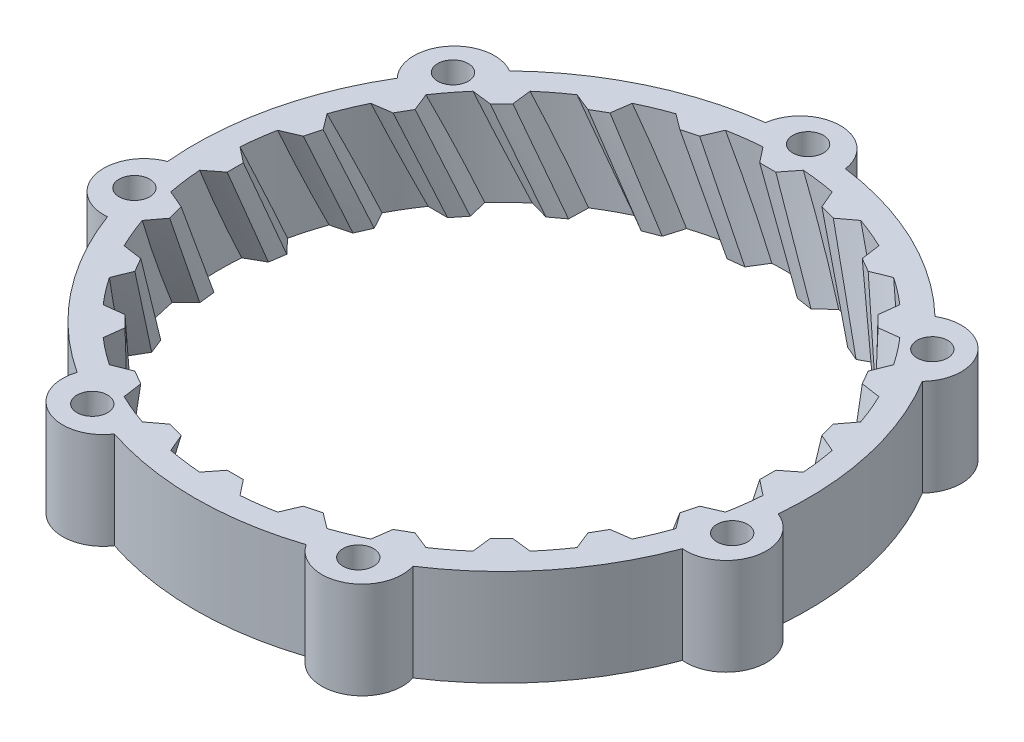
from build123d import *

# Parameters (mm, degrees)
SKETCH1_R           = 38
BOSS_EXTRUDE6_DEPTH = 6
SKETCH3_R           = 38
SKETCH3_R_2         = 35
BOSS_EXTRUDE7_DEPTH = 24
CIRPATTERN1_COUNT   = 24
BOSS_EXTRUDE8_DEPTH = 30
CUT_EXTRUDE1_DEPTH  = 30
CIRPATTERN2_COUNT   = 7
BOSS_EXTRUDE9_DEPTH = 7
SKETCH8_R           = 1.9
CUT_EXTRUDE2_DEPTH  = 13
SKETCH9_R           = 42
CUT_EXTRUDE6_DEPTH  = 18


with BuildPart() as part:
    # Sketch1 → Boss-Extrude6 (new body)
    with BuildSketch(Plane(origin=(0, 0, 0), x_dir=(1, 0, 0), z_dir=(0, 1, 0))):
        with Locations(Location((0, 0, 0), (0, 0, 270))):
            Circle(SKETCH1_R)
    extrude(amount=BOSS_EXTRUDE6_DEPTH)

    # Sketch3 → Boss-Extrude7 (add)
    with BuildSketch(Plane(origin=(0, 6, 0), x_dir=(1, 0, 0), z_dir=(0, 1, 0))):
        with Locations(Location((0, 0, 0), (0, 0, 270))):
            Circle(SKETCH3_R)
        with Locations(Location((0, 0, 0), (0, 0, 270))):
            Circle(SKETCH3_R_2, mode=Mode.SUBTRACT)
    extrude(amount=BOSS_EXTRUDE7_DEPTH)

    # Sketch4 → Loft1 section 0
    with BuildSketch(Plane(origin=(0, 6, 0), x_dir=(1, 0, 0), z_dir=(0, 1, 0))):
        with BuildLine():
            Line((1, 33), (-1, 33))
            Line((-1, 33), (-3.355280929, 36))
            Line((-3.355280929, 36), (3.355280929, 36))
            Line((3.355280929, 36), (1, 33))
        make_face()
    # Sketch5 → Loft1 section 1
    with BuildSketch(Plane(origin=(0, 18, 0), x_dir=(0.9889879611668934, 0, 0.147995988685341), z_dir=(0, 1, 0))):
        with BuildLine():
            Line((1, 33), (-1, 33))
            Line((-1, 33), (-3.355280929, 36))
            Line((-3.355280929, 36), (3.355280929, 36))
            Line((3.355280929, 36), (1, 33))
        make_face()
    loft1 = loft()

    # CirPattern1: Loft1 ×24 about axis
    cirpattern1_axis = Axis((0, 6, 0), (0, -1, 0))
    for i in range(1, CIRPATTERN1_COUNT):
        add(loft1.rotate(cirpattern1_axis, i * 360 / CIRPATTERN1_COUNT))

    # Mirror1: read off the stored shape, not the designer's step
    # Mirror1: loft between two sections, ruled curve by curve
    mirror1_from = [
        Edge.make_bspline([(-1, 30, -33), (-0.666666667, 30, -33), (-0.333333333, 30, -33), (0.333333333, 30, -33), (0.666666667, 30, -33), (1, 30, -33)], [0, 0, 0, 0, 0.5, 0.5, 1, 1, 1, 1], 3),
        Edge.make_bspline([(1, 30, -33), (1.392546821, 30, -33.5), (1.785093643, 30, -34), (2.570187286, 30, -35), (2.962734107, 30, -35.5), (3.355280929, 30, -36)], [0, 0, 0, 0, 0.5, 0.5, 1, 1, 1, 1], 3),
        Edge.make_bspline([(-3.355280929, 30, -36), (-2.962734107, 30, -35.5), (-2.570187286, 30, -35), (-1.785093643, 30, -34), (-1.392546821, 30, -33.5), (-1, 30, -33)], [0, 0, 0, 0, 0.5, 0.5, 1, 1, 1, 1], 3),
        Edge.make_line((-3.355280929, 30, -36), (3.355280929, 30, -36)),
    ]
    mirror1_to = [
        Edge.make_bspline([(3.894879665, 18, -32.784598707), (4.224542319, 18, -32.735266711), (4.554204973, 18, -32.685934715), (5.21353028, 18, -32.587270722), (5.543192934, 18, -32.537938726), (5.872855588, 18, -32.48860673)], [0, 0, 0, 0, 0.5, 0.5, 1, 1, 1, 1], 3),
        Edge.make_bspline([(5.872855588, 18, -32.48860673), (6.335077663, 18, -32.925005355), (6.797299738, 18, -33.361403981), (7.721743888, 18, -34.234201232), (8.183965962, 18, -34.670599858), (8.646188037, 18, -35.106998484)], [0, 0, 0, 0, 0.5, 0.5, 1, 1, 1, 1], 3),
        Edge.make_bspline([(2.009523148, 18, -36.10013472), (2.323749234, 18, -35.547545385), (2.63797532, 18, -34.994956049), (3.266427493, 18, -33.889777378), (3.580653579, 18, -33.337188043), (3.894879665, 18, -32.784598707)], [0, 0, 0, 0, 0.5, 0.5, 1, 1, 1, 1], 3),
        Edge.make_line((2.009523148, 18, -36.10013472), (8.646188037, 18, -35.106998484)),
    ]
    mirror1 = Solid(Shell([*[Face.make_surface_from_curves(mirror1_from[k], mirror1_to[k]) for k in range(4)], Face(Wire(mirror1_from)), Face(Wire(mirror1_to))]))
    add(mirror1)

    # Mirror1 2: loft between two sections, ruled curve by curve
    mirror1_2_from = [
        Edge.make_bspline([(7.575102662, 30, -32.134371313), (7.897077938, 30, -32.048098298), (8.219053213, 30, -31.961825283), (8.863003764, 30, -31.789279253), (9.184979039, 30, -31.703006237), (9.506954315, 30, -31.616733222)], [0, 0, 0, 0, 0.5, 0.5, 1, 1, 1, 1], 3),
        Edge.make_bspline([(9.506954315, 30, -31.616733222), (10.01553495, 30, -31.998097542), (10.524115585, 30, -32.379461862), (11.541276856, 30, -33.142190501), (12.049857492, 30, -33.523554821), (12.558438127, 30, -33.90491914)], [0, 0, 0, 0, 0.5, 0.5, 1, 1, 1, 1], 3),
        Edge.make_bspline([(6.07653312, 30, -35.641740352), (6.326294711, 30, -35.057178846), (6.576056301, 30, -34.472617339), (7.075579481, 30, -33.303494326), (7.325341072, 30, -32.718932819), (7.575102662, 30, -32.134371313)], [0, 0, 0, 0, 0.5, 0.5, 1, 1, 1, 1], 3),
        Edge.make_line((6.07653312, 30, -35.641740352), (12.558438127, 30, -33.90491914)),
    ]
    mirror1_2_to = [
        Edge.make_bspline([(12.247443391, 18, -30.65942156), (12.553105002, 18, -30.526447538), (12.858766613, 18, -30.393473515), (13.470089835, 18, -30.12752547), (13.775751446, 18, -29.994551448), (14.081413057, 18, -29.861577425)], [0, 0, 0, 0, 0.5, 0.5, 1, 1, 1, 1], 3),
        Edge.make_bspline([(14.081413057, 18, -29.861577425), (14.640833572, 18, -30.163474252), (15.200254087, 18, -30.465371079), (16.319095118, 18, -31.069164733), (16.878515633, 18, -31.37106156), (17.437936148, 18, -31.672958387)], [0, 0, 0, 0, 0.5, 0.5, 1, 1, 1, 1], 3),
        Edge.make_bspline([(11.284452703, 18, -34.349949597), (11.444951151, 18, -33.734861591), (11.605449599, 18, -33.119773584), (11.926446495, 18, -31.889597572), (12.086944943, 18, -31.274509566), (12.247443391, 18, -30.65942156)], [0, 0, 0, 0, 0.5, 0.5, 1, 1, 1, 1], 3),
        Edge.make_line((11.284452703, 18, -34.349949597), (17.437936148, 18, -31.672958387)),
    ]
    mirror1_2 = Solid(Shell([*[Face.make_surface_from_curves(mirror1_2_from[k], mirror1_2_to[k]) for k in range(4)], Face(Wire(mirror1_2_from)), Face(Wire(mirror1_2_to))]))
    add(mirror1_2)

    # Mirror1 3: loft between two sections, ruled curve by curve
    mirror1_3_from = [
        Edge.make_bspline([(15.633974596, 30, -29.078838325), (15.922649731, 30, -28.912171658), (16.211324865, 30, -28.745504992), (16.788675135, 30, -28.412171658), (17.077350269, 30, -28.245504992), (17.366025404, 30, -28.078838325)], [0, 0, 0, 0, 0.5, 0.5, 1, 1, 1, 1], 3),
        Edge.make_bspline([(17.366025404, 30, -28.078838325), (17.955980923, 30, -28.315577616), (18.545936443, 30, -28.552316907), (19.725847482, 30, -29.02579549), (20.315803002, 30, -29.262534781), (20.905758521, 30, -29.499274072)], [0, 0, 0, 0, 0.5, 0.5, 1, 1, 1, 1], 3),
        Edge.make_bspline([(15.094241479, 30, -32.854555001), (15.184196998, 30, -32.225268888), (15.274152518, 30, -31.595982775), (15.454063557, 30, -30.33741055), (15.544019077, 30, -29.708124437), (15.633974596, 30, -29.078838325)], [0, 0, 0, 0, 0.5, 0.5, 1, 1, 1, 1], 3),
        Edge.make_line((15.094241479, 30, -32.854555001), (20.905758521, 30, -29.499274072)),
    ]
    mirror1_3_to = [
        Edge.make_bspline([(19.765364089, 18, -26.444855501), (20.026194323, 18, -26.237301412), (20.287024558, 18, -26.029747323), (20.808685027, 18, -25.614639145), (21.069515262, 18, -25.407085057), (21.330345497, 18, -25.199530968)], [0, 0, 0, 0, 0.5, 0.5, 1, 1, 1, 1], 3),
        Edge.make_bspline([(21.330345497, 18, -25.199530968), (21.948840869, 18, -25.346352226), (22.567336241, 18, -25.493173485), (23.804326984, 18, -25.786816002), (24.422822356, 18, -25.93363726), (25.041317728, 18, -26.080458519)], [0, 0, 0, 0, 0.5, 0.5, 1, 1, 1, 1], 3),
        Edge.make_bspline([(19.790365456, 18, -30.258872174), (19.786198561, 18, -29.623202728), (19.782031667, 18, -28.987533283), (19.773697878, 18, -27.716194392), (19.769530983, 18, -27.080524946), (19.765364089, 18, -26.444855501)], [0, 0, 0, 0, 0.5, 0.5, 1, 1, 1, 1], 3),
        Edge.make_line((19.790365456, 18, -30.258872174), (25.041317728, 18, -26.080458519)),
    ]
    mirror1_3 = Solid(Shell([*[Face.make_surface_from_curves(mirror1_3_from[k], mirror1_3_to[k]) for k in range(4)], Face(Wire(mirror1_3_from)), Face(Wire(mirror1_3_to))]))
    add(mirror1_3)

    # Mirror1 4: loft between two sections, ruled curve by curve
    mirror1_4_from = [
        Edge.make_bspline([(22.627416998, 30, -24.04163056), (22.863119258, 30, -23.8059283), (23.098821519, 30, -23.57022604), (23.57022604, 30, -23.098821519), (23.8059283, 30, -22.863119258), (24.04163056, 30, -22.627416998)], [0, 0, 0, 0, 0.5, 0.5, 1, 1, 1, 1], 3),
        Edge.make_bspline([(24.04163056, 30, -22.627416998), (24.67275647, 30, -22.703397869), (25.30388238, 30, -22.77937874), (26.5661342, 30, -22.931340483), (27.19726011, 30, -23.007321354), (27.82838602, 30, -23.083302225)], [0, 0, 0, 0, 0.5, 0.5, 1, 1, 1, 1], 3),
        Edge.make_bspline([(23.083302225, 30, -27.82838602), (23.007321354, 30, -27.19726011), (22.931340483, 30, -26.5661342), (22.77937874, 30, -25.30388238), (22.703397869, 30, -24.67275647), (22.627416998, 30, -24.04163056)], [0, 0, 0, 0, 0.5, 0.5, 1, 1, 1, 1], 3),
        Edge.make_line((23.083302225, 30, -27.82838602), (27.82838602, 30, -23.083302225)),
    ]
    mirror1_4_to = [
        Edge.make_bspline([(25.936307888, 18, -20.428116241), (26.134531597, 18, -20.160126554), (26.332755305, 18, -19.892136867), (26.729202723, 18, -19.356157493), (26.927426432, 18, -19.088167806), (27.125650141, 18, -18.820178119)], [0, 0, 0, 0, 0.5, 0.5, 1, 1, 1, 1], 3),
        Edge.make_bspline([(27.125650141, 18, -18.820178119), (27.761070932, 18, -18.801918183), (28.396491723, 18, -18.783658247), (29.667333305, 18, -18.747138374), (30.302754096, 18, -18.728878438), (30.938174888, 18, -18.710618502)], [0, 0, 0, 0, 0.5, 0.5, 1, 1, 1, 1], 3),
        Edge.make_bspline([(26.947597507, 18, -24.105702618), (26.779049237, 18, -23.492771555), (26.610500967, 18, -22.879840492), (26.273404428, 18, -21.653978367), (26.104856158, 18, -21.041047304), (25.936307888, 18, -20.428116241)], [0, 0, 0, 0, 0.5, 0.5, 1, 1, 1, 1], 3),
        Edge.make_line((26.947597507, 18, -24.105702618), (30.938174888, 18, -18.710618502)),
    ]
    mirror1_4 = Solid(Shell([*[Face.make_surface_from_curves(mirror1_4_from[k], mirror1_4_to[k]) for k in range(4)], Face(Wire(mirror1_4_from)), Face(Wire(mirror1_4_to))]))
    add(mirror1_4)

    # Mirror1 5: loft between two sections, ruled curve by curve
    mirror1_5_from = [
        Edge.make_bspline([(28.078838325, 30, -17.366025404), (28.245504992, 30, -17.077350269), (28.412171658, 30, -16.788675135), (28.745504992, 30, -16.211324865), (28.912171658, 30, -15.922649731), (29.078838325, 30, -15.633974596)], [0, 0, 0, 0, 0.5, 0.5, 1, 1, 1, 1], 3),
        Edge.make_bspline([(29.078838325, 30, -15.633974596), (29.708124437, 30, -15.544019077), (30.33741055, 30, -15.454063557), (31.595982775, 30, -15.274152518), (32.225268888, 30, -15.184196998), (32.854555001, 30, -15.094241479)], [0, 0, 0, 0, 0.5, 0.5, 1, 1, 1, 1], 3),
        Edge.make_bspline([(29.499274072, 30, -20.905758521), (29.262534781, 30, -20.315803002), (29.02579549, 30, -19.725847482), (28.552316907, 30, -18.545936443), (28.315577616, 30, -17.955980923), (28.078838325, 30, -17.366025404)], [0, 0, 0, 0, 0.5, 0.5, 1, 1, 1, 1], 3),
        Edge.make_line((29.499274072, 30, -20.905758521), (32.854555001, 30, -15.094241479)),
    ]
    mirror1_5_to = [
        Edge.make_bspline([(30.339735166, 18, -13.019234619), (30.461843731, 18, -12.709072388), (30.583952296, 18, -12.398910157), (30.828169426, 18, -11.778585695), (30.950277991, 18, -11.468423464), (31.072386555, 18, -11.158261233)], [0, 0, 0, 0, 0.5, 0.5, 1, 1, 1, 1], 3),
        Edge.make_bspline([(31.072386555, 18, -11.158261233), (31.681429889, 18, -10.976164487), (32.290473222, 18, -10.794067741), (33.508559889, 18, -10.429874248), (34.117603223, 18, -10.247777502), (34.726646556, 18, -10.065680756)], [0, 0, 0, 0, 0.5, 0.5, 1, 1, 1, 1], 3),
        Edge.make_bspline([(32.268395322, 18, -16.309769265), (31.946951963, 18, -15.761346824), (31.625508603, 18, -15.212924383), (30.982621885, 18, -14.116079501), (30.661178525, 18, -13.56765706), (30.339735166, 18, -13.019234619)], [0, 0, 0, 0, 0.5, 0.5, 1, 1, 1, 1], 3),
        Edge.make_line((32.268395322, 18, -16.309769265), (34.726646556, 18, -10.065680756)),
    ]
    mirror1_5 = Solid(Shell([*[Face.make_surface_from_curves(mirror1_5_from[k], mirror1_5_to[k]) for k in range(4)], Face(Wire(mirror1_5_from)), Face(Wire(mirror1_5_to))]))
    add(mirror1_5)

    # Mirror1 6: loft between two sections, ruled curve by curve
    mirror1_6_from = [
        Edge.make_bspline([(31.616733222, 30, -9.506954315), (31.703006237, 30, -9.184979039), (31.789279253, 30, -8.863003764), (31.961825283, 30, -8.219053213), (32.048098298, 30, -7.897077938), (32.134371313, 30, -7.575102662)], [0, 0, 0, 0, 0.5, 0.5, 1, 1, 1, 1], 3),
        Edge.make_bspline([(32.134371313, 30, -7.575102662), (32.718932819, 30, -7.325341072), (33.303494326, 30, -7.075579481), (34.472617339, 30, -6.576056301), (35.057178846, 30, -6.326294711), (35.641740352, 30, -6.07653312)], [0, 0, 0, 0, 0.5, 0.5, 1, 1, 1, 1], 3),
        Edge.make_bspline([(33.90491914, 30, -12.558438127), (33.523554821, 30, -12.049857492), (33.142190501, 30, -11.541276856), (32.379461862, 30, -10.524115585), (31.998097542, 30, -10.01553495), (31.616733222, 30, -9.506954315)], [0, 0, 0, 0, 0.5, 0.5, 1, 1, 1, 1], 3),
        Edge.make_line((33.90491914, 30, -12.558438127), (35.641740352, 30, -6.07653312)),
    ]
    mirror1_6_to = [
        Edge.make_bspline([(32.675559632, 18, -4.723113672), (32.713231556, 18, -4.391915941), (32.75090348, 18, -4.06071821), (32.826247328, 18, -3.398322747), (32.863919252, 18, -3.067125016), (32.901591176, 18, -2.735927284)], [0, 0, 0, 0, 0.5, 0.5, 1, 1, 1, 1], 3),
        Edge.make_bspline([(32.901591176, 18, -2.735927284), (33.442751755, 18, -2.40240332), (33.983912334, 18, -2.068879356), (35.066233492, 18, -1.401831428), (35.607394071, 18, -1.068307464), (36.14855465, 18, -0.7347835)], [0, 0, 0, 0, 0.5, 0.5, 1, 1, 1, 1], 3),
        Edge.make_bspline([(35.390155321, 18, -7.402352089), (34.937722706, 18, -6.955812353), (34.485290091, 18, -6.509272617), (33.580424861, 18, -5.616193145), (33.127992247, 18, -5.169653408), (32.675559632, 18, -4.723113672)], [0, 0, 0, 0, 0.5, 0.5, 1, 1, 1, 1], 3),
        Edge.make_line((35.390155321, 18, -7.402352089), (36.14855465, 18, -0.7347835)),
    ]
    mirror1_6 = Solid(Shell([*[Face.make_surface_from_curves(mirror1_6_from[k], mirror1_6_to[k]) for k in range(4)], Face(Wire(mirror1_6_from)), Face(Wire(mirror1_6_to))]))
    add(mirror1_6)

    # Mirror1 7: loft between two sections, ruled curve by curve
    mirror1_7_from = [
        Edge.make_bspline([(33, 30, -1), (33, 30, -0.666666667), (33, 30, -0.333333333), (33, 30, 0.333333333), (33, 30, 0.666666667), (33, 30, 1)], [0, 0, 0, 0, 0.5, 0.5, 1, 1, 1, 1], 3),
        Edge.make_bspline([(33, 30, 1), (33.5, 30, 1.392546821), (34, 30, 1.785093643), (35, 30, 2.570187286), (35.5, 30, 2.962734107), (36, 30, 3.355280929)], [0, 0, 0, 0, 0.5, 0.5, 1, 1, 1, 1], 3),
        Edge.make_bspline([(36, 30, -3.355280929), (35.5, 30, -2.962734107), (35, 30, -2.570187286), (34, 30, -1.785093643), (33.5, 30, -1.392546821), (33, 30, -1)], [0, 0, 0, 0, 0.5, 0.5, 1, 1, 1, 1], 3),
        Edge.make_line((36, 30, -3.355280929), (36, 30, 3.355280929)),
    ]
    mirror1_7_to = [
        Edge.make_bspline([(32.784598707, 18, 3.894879665), (32.735266711, 18, 4.224542319), (32.685934715, 18, 4.554204973), (32.587270722, 18, 5.21353028), (32.537938726, 18, 5.543192934), (32.48860673, 18, 5.872855588)], [0, 0, 0, 0, 0.5, 0.5, 1, 1, 1, 1], 3),
        Edge.make_bspline([(32.48860673, 18, 5.872855588), (32.925005355, 18, 6.335077663), (33.361403981, 18, 6.797299738), (34.234201232, 18, 7.721743888), (34.670599858, 18, 8.183965962), (35.106998484, 18, 8.646188037)], [0, 0, 0, 0, 0.5, 0.5, 1, 1, 1, 1], 3),
        Edge.make_bspline([(36.10013472, 18, 2.009523148), (35.547545385, 18, 2.323749234), (34.994956049, 18, 2.63797532), (33.889777378, 18, 3.266427493), (33.337188043, 18, 3.580653579), (32.784598707, 18, 3.894879665)], [0, 0, 0, 0, 0.5, 0.5, 1, 1, 1, 1], 3),
        Edge.make_line((36.10013472, 18, 2.009523148), (35.106998484, 18, 8.646188037)),
    ]
    mirror1_7 = Solid(Shell([*[Face.make_surface_from_curves(mirror1_7_from[k], mirror1_7_to[k]) for k in range(4)], Face(Wire(mirror1_7_from)), Face(Wire(mirror1_7_to))]))
    add(mirror1_7)

    # Mirror1 8: loft between two sections, ruled curve by curve
    mirror1_8_from = [
        Edge.make_bspline([(32.134371313, 30, 7.575102662), (32.048098298, 30, 7.897077938), (31.961825283, 30, 8.219053213), (31.789279253, 30, 8.863003764), (31.703006237, 30, 9.184979039), (31.616733222, 30, 9.506954315)], [0, 0, 0, 0, 0.5, 0.5, 1, 1, 1, 1], 3),
        Edge.make_bspline([(31.616733222, 30, 9.506954315), (31.998097542, 30, 10.01553495), (32.379461862, 30, 10.524115585), (33.142190501, 30, 11.541276856), (33.523554821, 30, 12.049857492), (33.90491914, 30, 12.558438127)], [0, 0, 0, 0, 0.5, 0.5, 1, 1, 1, 1], 3),
        Edge.make_bspline([(35.641740352, 30, 6.07653312), (35.057178846, 30, 6.326294711), (34.472617339, 30, 6.576056301), (33.303494326, 30, 7.075579481), (32.718932819, 30, 7.325341072), (32.134371313, 30, 7.575102662)], [0, 0, 0, 0, 0.5, 0.5, 1, 1, 1, 1], 3),
        Edge.make_line((35.641740352, 30, 6.07653312), (33.90491914, 30, 12.558438127)),
    ]
    mirror1_8_to = [
        Edge.make_bspline([(30.65942156, 18, 12.247443391), (30.526447538, 18, 12.553105002), (30.393473515, 18, 12.858766613), (30.12752547, 18, 13.470089835), (29.994551448, 18, 13.775751446), (29.861577425, 18, 14.081413057)], [0, 0, 0, 0, 0.5, 0.5, 1, 1, 1, 1], 3),
        Edge.make_bspline([(29.861577425, 18, 14.081413057), (30.163474252, 18, 14.640833572), (30.465371079, 18, 15.200254087), (31.069164733, 18, 16.319095118), (31.37106156, 18, 16.878515633), (31.672958387, 18, 17.437936148)], [0, 0, 0, 0, 0.5, 0.5, 1, 1, 1, 1], 3),
        Edge.make_bspline([(34.349949597, 18, 11.284452703), (33.734861591, 18, 11.444951151), (33.119773584, 18, 11.605449599), (31.889597572, 18, 11.926446495), (31.274509566, 18, 12.086944943), (30.65942156, 18, 12.247443391)], [0, 0, 0, 0, 0.5, 0.5, 1, 1, 1, 1], 3),
        Edge.make_line((34.349949597, 18, 11.284452703), (31.672958387, 18, 17.437936148)),
    ]
    mirror1_8 = Solid(Shell([*[Face.make_surface_from_curves(mirror1_8_from[k], mirror1_8_to[k]) for k in range(4)], Face(Wire(mirror1_8_from)), Face(Wire(mirror1_8_to))]))
    add(mirror1_8)

    # Mirror1 9: loft between two sections, ruled curve by curve
    mirror1_9_from = [
        Edge.make_bspline([(29.078838325, 30, 15.633974596), (28.912171658, 30, 15.922649731), (28.745504992, 30, 16.211324865), (28.412171658, 30, 16.788675135), (28.245504992, 30, 17.077350269), (28.078838325, 30, 17.366025404)], [0, 0, 0, 0, 0.5, 0.5, 1, 1, 1, 1], 3),
        Edge.make_bspline([(28.078838325, 30, 17.366025404), (28.315577616, 30, 17.955980923), (28.552316907, 30, 18.545936443), (29.02579549, 30, 19.725847482), (29.262534781, 30, 20.315803002), (29.499274072, 30, 20.905758521)], [0, 0, 0, 0, 0.5, 0.5, 1, 1, 1, 1], 3),
        Edge.make_bspline([(32.854555001, 30, 15.094241479), (32.225268888, 30, 15.184196998), (31.595982775, 30, 15.274152518), (30.33741055, 30, 15.454063557), (29.708124437, 30, 15.544019077), (29.078838325, 30, 15.633974596)], [0, 0, 0, 0, 0.5, 0.5, 1, 1, 1, 1], 3),
        Edge.make_line((32.854555001, 30, 15.094241479), (29.499274072, 30, 20.905758521)),
    ]
    mirror1_9_to = [
        Edge.make_bspline([(26.444855501, 18, 19.765364089), (26.237301412, 18, 20.026194323), (26.029747323, 18, 20.287024558), (25.614639145, 18, 20.808685027), (25.407085057, 18, 21.069515262), (25.199530968, 18, 21.330345497)], [0, 0, 0, 0, 0.5, 0.5, 1, 1, 1, 1], 3),
        Edge.make_bspline([(25.199530968, 18, 21.330345497), (25.346352226, 18, 21.948840869), (25.493173485, 18, 22.567336241), (25.786816002, 18, 23.804326984), (25.93363726, 18, 24.422822356), (26.080458519, 18, 25.041317728)], [0, 0, 0, 0, 0.5, 0.5, 1, 1, 1, 1], 3),
        Edge.make_bspline([(30.258872174, 18, 19.790365456), (29.623202728, 18, 19.786198561), (28.987533283, 18, 19.782031667), (27.716194392, 18, 19.773697878), (27.080524946, 18, 19.769530983), (26.444855501, 18, 19.765364089)], [0, 0, 0, 0, 0.5, 0.5, 1, 1, 1, 1], 3),
        Edge.make_line((30.258872174, 18, 19.790365456), (26.080458519, 18, 25.041317728)),
    ]
    mirror1_9 = Solid(Shell([*[Face.make_surface_from_curves(mirror1_9_from[k], mirror1_9_to[k]) for k in range(4)], Face(Wire(mirror1_9_from)), Face(Wire(mirror1_9_to))]))
    add(mirror1_9)

    # Mirror1 10: loft between two sections, ruled curve by curve
    mirror1_10_from = [
        Edge.make_bspline([(24.04163056, 30, 22.627416998), (23.8059283, 30, 22.863119258), (23.57022604, 30, 23.098821519), (23.098821519, 30, 23.57022604), (22.863119258, 30, 23.8059283), (22.627416998, 30, 24.04163056)], [0, 0, 0, 0, 0.5, 0.5, 1, 1, 1, 1], 3),
        Edge.make_bspline([(22.627416998, 30, 24.04163056), (22.703397869, 30, 24.67275647), (22.77937874, 30, 25.30388238), (22.931340483, 30, 26.5661342), (23.007321354, 30, 27.19726011), (23.083302225, 30, 27.82838602)], [0, 0, 0, 0, 0.5, 0.5, 1, 1, 1, 1], 3),
        Edge.make_bspline([(27.82838602, 30, 23.083302225), (27.19726011, 30, 23.007321354), (26.5661342, 30, 22.931340483), (25.30388238, 30, 22.77937874), (24.67275647, 30, 22.703397869), (24.04163056, 30, 22.627416998)], [0, 0, 0, 0, 0.5, 0.5, 1, 1, 1, 1], 3),
        Edge.make_line((27.82838602, 30, 23.083302225), (23.083302225, 30, 27.82838602)),
    ]
    mirror1_10_to = [
        Edge.make_bspline([(20.428116241, 18, 25.936307888), (20.160126554, 18, 26.134531597), (19.892136867, 18, 26.332755305), (19.356157493, 18, 26.729202723), (19.088167806, 18, 26.927426432), (18.820178119, 18, 27.125650141)], [0, 0, 0, 0, 0.5, 0.5, 1, 1, 1, 1], 3),
        Edge.make_bspline([(18.820178119, 18, 27.125650141), (18.801918183, 18, 27.761070932), (18.783658247, 18, 28.396491723), (18.747138374, 18, 29.667333305), (18.728878438, 18, 30.302754096), (18.710618502, 18, 30.938174888)], [0, 0, 0, 0, 0.5, 0.5, 1, 1, 1, 1], 3),
        Edge.make_bspline([(24.105702618, 18, 26.947597507), (23.492771555, 18, 26.779049237), (22.879840492, 18, 26.610500967), (21.653978367, 18, 26.273404428), (21.041047304, 18, 26.104856158), (20.428116241, 18, 25.936307888)], [0, 0, 0, 0, 0.5, 0.5, 1, 1, 1, 1], 3),
        Edge.make_line((24.105702618, 18, 26.947597507), (18.710618502, 18, 30.938174888)),
    ]
    mirror1_10 = Solid(Shell([*[Face.make_surface_from_curves(mirror1_10_from[k], mirror1_10_to[k]) for k in range(4)], Face(Wire(mirror1_10_from)), Face(Wire(mirror1_10_to))]))
    add(mirror1_10)

    # Mirror1 11: loft between two sections, ruled curve by curve
    mirror1_11_from = [
        Edge.make_bspline([(17.366025404, 30, 28.078838325), (17.077350269, 30, 28.245504992), (16.788675135, 30, 28.412171658), (16.211324865, 30, 28.745504992), (15.922649731, 30, 28.912171658), (15.633974596, 30, 29.078838325)], [0, 0, 0, 0, 0.5, 0.5, 1, 1, 1, 1], 3),
        Edge.make_bspline([(15.633974596, 30, 29.078838325), (15.544019077, 30, 29.708124437), (15.454063557, 30, 30.33741055), (15.274152518, 30, 31.595982775), (15.184196998, 30, 32.225268888), (15.094241479, 30, 32.854555001)], [0, 0, 0, 0, 0.5, 0.5, 1, 1, 1, 1], 3),
        Edge.make_bspline([(20.905758521, 30, 29.499274072), (20.315803002, 30, 29.262534781), (19.725847482, 30, 29.02579549), (18.545936443, 30, 28.552316907), (17.955980923, 30, 28.315577616), (17.366025404, 30, 28.078838325)], [0, 0, 0, 0, 0.5, 0.5, 1, 1, 1, 1], 3),
        Edge.make_line((20.905758521, 30, 29.499274072), (15.094241479, 30, 32.854555001)),
    ]
    mirror1_11_to = [
        Edge.make_bspline([(13.019234619, 18, 30.339735166), (12.709072388, 18, 30.461843731), (12.398910157, 18, 30.583952296), (11.778585695, 18, 30.828169426), (11.468423464, 18, 30.950277991), (11.158261233, 18, 31.072386555)], [0, 0, 0, 0, 0.5, 0.5, 1, 1, 1, 1], 3),
        Edge.make_bspline([(11.158261233, 18, 31.072386555), (10.976164487, 18, 31.681429889), (10.794067741, 18, 32.290473222), (10.429874248, 18, 33.508559889), (10.247777502, 18, 34.117603223), (10.065680756, 18, 34.726646556)], [0, 0, 0, 0, 0.5, 0.5, 1, 1, 1, 1], 3),
        Edge.make_bspline([(16.309769265, 18, 32.268395322), (15.761346824, 18, 31.946951963), (15.212924383, 18, 31.625508603), (14.116079501, 18, 30.982621885), (13.56765706, 18, 30.661178525), (13.019234619, 18, 30.339735166)], [0, 0, 0, 0, 0.5, 0.5, 1, 1, 1, 1], 3),
        Edge.make_line((16.309769265, 18, 32.268395322), (10.065680756, 18, 34.726646556)),
    ]
    mirror1_11 = Solid(Shell([*[Face.make_surface_from_curves(mirror1_11_from[k], mirror1_11_to[k]) for k in range(4)], Face(Wire(mirror1_11_from)), Face(Wire(mirror1_11_to))]))
    add(mirror1_11)

    # Mirror1 12: loft between two sections, ruled curve by curve
    mirror1_12_from = [
        Edge.make_bspline([(9.506954315, 30, 31.616733222), (9.184979039, 30, 31.703006237), (8.863003764, 30, 31.789279253), (8.219053213, 30, 31.961825283), (7.897077938, 30, 32.048098298), (7.575102662, 30, 32.134371313)], [0, 0, 0, 0, 0.5, 0.5, 1, 1, 1, 1], 3),
        Edge.make_bspline([(7.575102662, 30, 32.134371313), (7.325341072, 30, 32.718932819), (7.075579481, 30, 33.303494326), (6.576056301, 30, 34.472617339), (6.326294711, 30, 35.057178846), (6.07653312, 30, 35.641740352)], [0, 0, 0, 0, 0.5, 0.5, 1, 1, 1, 1], 3),
        Edge.make_bspline([(12.558438127, 30, 33.90491914), (12.049857492, 30, 33.523554821), (11.541276856, 30, 33.142190501), (10.524115585, 30, 32.379461862), (10.01553495, 30, 31.998097542), (9.506954315, 30, 31.616733222)], [0, 0, 0, 0, 0.5, 0.5, 1, 1, 1, 1], 3),
        Edge.make_line((12.558438127, 30, 33.90491914), (6.07653312, 30, 35.641740352)),
    ]
    mirror1_12_to = [
        Edge.make_bspline([(4.723113672, 18, 32.675559632), (4.391915941, 18, 32.713231556), (4.06071821, 18, 32.75090348), (3.398322747, 18, 32.826247328), (3.067125016, 18, 32.863919252), (2.735927284, 18, 32.901591176)], [0, 0, 0, 0, 0.5, 0.5, 1, 1, 1, 1], 3),
        Edge.make_bspline([(2.735927284, 18, 32.901591176), (2.40240332, 18, 33.442751755), (2.068879356, 18, 33.983912334), (1.401831428, 18, 35.066233492), (1.068307464, 18, 35.607394071), (0.7347835, 18, 36.14855465)], [0, 0, 0, 0, 0.5, 0.5, 1, 1, 1, 1], 3),
        Edge.make_bspline([(7.402352089, 18, 35.390155321), (6.955812353, 18, 34.937722706), (6.509272617, 18, 34.485290091), (5.616193145, 18, 33.580424861), (5.169653408, 18, 33.127992247), (4.723113672, 18, 32.675559632)], [0, 0, 0, 0, 0.5, 0.5, 1, 1, 1, 1], 3),
        Edge.make_line((7.402352089, 18, 35.390155321), (0.7347835, 18, 36.14855465)),
    ]
    mirror1_12 = Solid(Shell([*[Face.make_surface_from_curves(mirror1_12_from[k], mirror1_12_to[k]) for k in range(4)], Face(Wire(mirror1_12_from)), Face(Wire(mirror1_12_to))]))
    add(mirror1_12)

    # Mirror1 13: loft between two sections, ruled curve by curve
    mirror1_13_from = [
        Edge.make_bspline([(1, 30, 33), (0.666666667, 30, 33), (0.333333333, 30, 33), (-0.333333333, 30, 33), (-0.666666667, 30, 33), (-1, 30, 33)], [0, 0, 0, 0, 0.5, 0.5, 1, 1, 1, 1], 3),
        Edge.make_bspline([(-1, 30, 33), (-1.392546821, 30, 33.5), (-1.785093643, 30, 34), (-2.570187286, 30, 35), (-2.962734107, 30, 35.5), (-3.355280929, 30, 36)], [0, 0, 0, 0, 0.5, 0.5, 1, 1, 1, 1], 3),
        Edge.make_bspline([(3.355280929, 30, 36), (2.962734107, 30, 35.5), (2.570187286, 30, 35), (1.785093643, 30, 34), (1.392546821, 30, 33.5), (1, 30, 33)], [0, 0, 0, 0, 0.5, 0.5, 1, 1, 1, 1], 3),
        Edge.make_line((3.355280929, 30, 36), (-3.355280929, 30, 36)),
    ]
    mirror1_13_to = [
        Edge.make_bspline([(-3.894879665, 18, 32.784598707), (-4.224542319, 18, 32.735266711), (-4.554204973, 18, 32.685934715), (-5.21353028, 18, 32.587270722), (-5.543192934, 18, 32.537938726), (-5.872855588, 18, 32.48860673)], [0, 0, 0, 0, 0.5, 0.5, 1, 1, 1, 1], 3),
        Edge.make_bspline([(-5.872855588, 18, 32.48860673), (-6.335077663, 18, 32.925005355), (-6.797299738, 18, 33.361403981), (-7.721743888, 18, 34.234201232), (-8.183965962, 18, 34.670599858), (-8.646188037, 18, 35.106998484)], [0, 0, 0, 0, 0.5, 0.5, 1, 1, 1, 1], 3),
        Edge.make_bspline([(-2.009523148, 18, 36.10013472), (-2.323749234, 18, 35.547545385), (-2.63797532, 18, 34.994956049), (-3.266427493, 18, 33.889777378), (-3.580653579, 18, 33.337188043), (-3.894879665, 18, 32.784598707)], [0, 0, 0, 0, 0.5, 0.5, 1, 1, 1, 1], 3),
        Edge.make_line((-2.009523148, 18, 36.10013472), (-8.646188037, 18, 35.106998484)),
    ]
    mirror1_13 = Solid(Shell([*[Face.make_surface_from_curves(mirror1_13_from[k], mirror1_13_to[k]) for k in range(4)], Face(Wire(mirror1_13_from)), Face(Wire(mirror1_13_to))]))
    add(mirror1_13)

    # Mirror1 14: loft between two sections, ruled curve by curve
    mirror1_14_from = [
        Edge.make_bspline([(-7.575102662, 30, 32.134371313), (-7.897077938, 30, 32.048098298), (-8.219053213, 30, 31.961825283), (-8.863003764, 30, 31.789279253), (-9.184979039, 30, 31.703006237), (-9.506954315, 30, 31.616733222)], [0, 0, 0, 0, 0.5, 0.5, 1, 1, 1, 1], 3),
        Edge.make_bspline([(-9.506954315, 30, 31.616733222), (-10.01553495, 30, 31.998097542), (-10.524115585, 30, 32.379461862), (-11.541276856, 30, 33.142190501), (-12.049857492, 30, 33.523554821), (-12.558438127, 30, 33.90491914)], [0, 0, 0, 0, 0.5, 0.5, 1, 1, 1, 1], 3),
        Edge.make_bspline([(-6.07653312, 30, 35.641740352), (-6.326294711, 30, 35.057178846), (-6.576056301, 30, 34.472617339), (-7.075579481, 30, 33.303494326), (-7.325341072, 30, 32.718932819), (-7.575102662, 30, 32.134371313)], [0, 0, 0, 0, 0.5, 0.5, 1, 1, 1, 1], 3),
        Edge.make_line((-6.07653312, 30, 35.641740352), (-12.558438127, 30, 33.90491914)),
    ]
    mirror1_14_to = [
        Edge.make_bspline([(-12.247443391, 18, 30.65942156), (-12.553105002, 18, 30.526447538), (-12.858766613, 18, 30.393473515), (-13.470089835, 18, 30.12752547), (-13.775751446, 18, 29.994551448), (-14.081413057, 18, 29.861577425)], [0, 0, 0, 0, 0.5, 0.5, 1, 1, 1, 1], 3),
        Edge.make_bspline([(-14.081413057, 18, 29.861577425), (-14.640833572, 18, 30.163474252), (-15.200254087, 18, 30.465371079), (-16.319095118, 18, 31.069164733), (-16.878515633, 18, 31.37106156), (-17.437936148, 18, 31.672958387)], [0, 0, 0, 0, 0.5, 0.5, 1, 1, 1, 1], 3),
        Edge.make_bspline([(-11.284452703, 18, 34.349949597), (-11.444951151, 18, 33.734861591), (-11.605449599, 18, 33.119773584), (-11.926446495, 18, 31.889597572), (-12.086944943, 18, 31.274509566), (-12.247443391, 18, 30.65942156)], [0, 0, 0, 0, 0.5, 0.5, 1, 1, 1, 1], 3),
        Edge.make_line((-11.284452703, 18, 34.349949597), (-17.437936148, 18, 31.672958387)),
    ]
    mirror1_14 = Solid(Shell([*[Face.make_surface_from_curves(mirror1_14_from[k], mirror1_14_to[k]) for k in range(4)], Face(Wire(mirror1_14_from)), Face(Wire(mirror1_14_to))]))
    add(mirror1_14)

    # Mirror1 15: loft between two sections, ruled curve by curve
    mirror1_15_from = [
        Edge.make_bspline([(-15.633974596, 30, 29.078838325), (-15.922649731, 30, 28.912171658), (-16.211324865, 30, 28.745504992), (-16.788675135, 30, 28.412171658), (-17.077350269, 30, 28.245504992), (-17.366025404, 30, 28.078838325)], [0, 0, 0, 0, 0.5, 0.5, 1, 1, 1, 1], 3),
        Edge.make_bspline([(-17.366025404, 30, 28.078838325), (-17.955980923, 30, 28.315577616), (-18.545936443, 30, 28.552316907), (-19.725847482, 30, 29.02579549), (-20.315803002, 30, 29.262534781), (-20.905758521, 30, 29.499274072)], [0, 0, 0, 0, 0.5, 0.5, 1, 1, 1, 1], 3),
        Edge.make_bspline([(-15.094241479, 30, 32.854555001), (-15.184196998, 30, 32.225268888), (-15.274152518, 30, 31.595982775), (-15.454063557, 30, 30.33741055), (-15.544019077, 30, 29.708124437), (-15.633974596, 30, 29.078838325)], [0, 0, 0, 0, 0.5, 0.5, 1, 1, 1, 1], 3),
        Edge.make_line((-15.094241479, 30, 32.854555001), (-20.905758521, 30, 29.499274072)),
    ]
    mirror1_15_to = [
        Edge.make_bspline([(-19.765364089, 18, 26.444855501), (-20.026194323, 18, 26.237301412), (-20.287024558, 18, 26.029747323), (-20.808685027, 18, 25.614639145), (-21.069515262, 18, 25.407085057), (-21.330345497, 18, 25.199530968)], [0, 0, 0, 0, 0.5, 0.5, 1, 1, 1, 1], 3),
        Edge.make_bspline([(-21.330345497, 18, 25.199530968), (-21.948840869, 18, 25.346352226), (-22.567336241, 18, 25.493173485), (-23.804326984, 18, 25.786816002), (-24.422822356, 18, 25.93363726), (-25.041317728, 18, 26.080458519)], [0, 0, 0, 0, 0.5, 0.5, 1, 1, 1, 1], 3),
        Edge.make_bspline([(-19.790365456, 18, 30.258872174), (-19.786198561, 18, 29.623202728), (-19.782031667, 18, 28.987533283), (-19.773697878, 18, 27.716194392), (-19.769530983, 18, 27.080524946), (-19.765364089, 18, 26.444855501)], [0, 0, 0, 0, 0.5, 0.5, 1, 1, 1, 1], 3),
        Edge.make_line((-19.790365456, 18, 30.258872174), (-25.041317728, 18, 26.080458519)),
    ]
    mirror1_15 = Solid(Shell([*[Face.make_surface_from_curves(mirror1_15_from[k], mirror1_15_to[k]) for k in range(4)], Face(Wire(mirror1_15_from)), Face(Wire(mirror1_15_to))]))
    add(mirror1_15)

    # Mirror1 16: loft between two sections, ruled curve by curve
    mirror1_16_from = [
        Edge.make_bspline([(-22.627416998, 30, 24.04163056), (-22.863119258, 30, 23.8059283), (-23.098821519, 30, 23.57022604), (-23.57022604, 30, 23.098821519), (-23.8059283, 30, 22.863119258), (-24.04163056, 30, 22.627416998)], [0, 0, 0, 0, 0.5, 0.5, 1, 1, 1, 1], 3),
        Edge.make_bspline([(-24.04163056, 30, 22.627416998), (-24.67275647, 30, 22.703397869), (-25.30388238, 30, 22.77937874), (-26.5661342, 30, 22.931340483), (-27.19726011, 30, 23.007321354), (-27.82838602, 30, 23.083302225)], [0, 0, 0, 0, 0.5, 0.5, 1, 1, 1, 1], 3),
        Edge.make_bspline([(-23.083302225, 30, 27.82838602), (-23.007321354, 30, 27.19726011), (-22.931340483, 30, 26.5661342), (-22.77937874, 30, 25.30388238), (-22.703397869, 30, 24.67275647), (-22.627416998, 30, 24.04163056)], [0, 0, 0, 0, 0.5, 0.5, 1, 1, 1, 1], 3),
        Edge.make_line((-23.083302225, 30, 27.82838602), (-27.82838602, 30, 23.083302225)),
    ]
    mirror1_16_to = [
        Edge.make_bspline([(-25.936307888, 18, 20.428116241), (-26.134531597, 18, 20.160126554), (-26.332755305, 18, 19.892136867), (-26.729202723, 18, 19.356157493), (-26.927426432, 18, 19.088167806), (-27.125650141, 18, 18.820178119)], [0, 0, 0, 0, 0.5, 0.5, 1, 1, 1, 1], 3),
        Edge.make_bspline([(-27.125650141, 18, 18.820178119), (-27.761070932, 18, 18.801918183), (-28.396491723, 18, 18.783658247), (-29.667333305, 18, 18.747138374), (-30.302754096, 18, 18.728878438), (-30.938174888, 18, 18.710618502)], [0, 0, 0, 0, 0.5, 0.5, 1, 1, 1, 1], 3),
        Edge.make_bspline([(-26.947597507, 18, 24.105702618), (-26.779049237, 18, 23.492771555), (-26.610500967, 18, 22.879840492), (-26.273404428, 18, 21.653978367), (-26.104856158, 18, 21.041047304), (-25.936307888, 18, 20.428116241)], [0, 0, 0, 0, 0.5, 0.5, 1, 1, 1, 1], 3),
        Edge.make_line((-26.947597507, 18, 24.105702618), (-30.938174888, 18, 18.710618502)),
    ]
    mirror1_16 = Solid(Shell([*[Face.make_surface_from_curves(mirror1_16_from[k], mirror1_16_to[k]) for k in range(4)], Face(Wire(mirror1_16_from)), Face(Wire(mirror1_16_to))]))
    add(mirror1_16)

    # Mirror1 17: loft between two sections, ruled curve by curve
    mirror1_17_from = [
        Edge.make_bspline([(-28.078838325, 30, 17.366025404), (-28.245504992, 30, 17.077350269), (-28.412171658, 30, 16.788675135), (-28.745504992, 30, 16.211324865), (-28.912171658, 30, 15.922649731), (-29.078838325, 30, 15.633974596)], [0, 0, 0, 0, 0.5, 0.5, 1, 1, 1, 1], 3),
        Edge.make_bspline([(-29.078838325, 30, 15.633974596), (-29.708124437, 30, 15.544019077), (-30.33741055, 30, 15.454063557), (-31.595982775, 30, 15.274152518), (-32.225268888, 30, 15.184196998), (-32.854555001, 30, 15.094241479)], [0, 0, 0, 0, 0.5, 0.5, 1, 1, 1, 1], 3),
        Edge.make_bspline([(-29.499274072, 30, 20.905758521), (-29.262534781, 30, 20.315803002), (-29.02579549, 30, 19.725847482), (-28.552316907, 30, 18.545936443), (-28.315577616, 30, 17.955980923), (-28.078838325, 30, 17.366025404)], [0, 0, 0, 0, 0.5, 0.5, 1, 1, 1, 1], 3),
        Edge.make_line((-29.499274072, 30, 20.905758521), (-32.854555001, 30, 15.094241479)),
    ]
    mirror1_17_to = [
        Edge.make_bspline([(-30.339735166, 18, 13.019234619), (-30.461843731, 18, 12.709072388), (-30.583952296, 18, 12.398910157), (-30.828169426, 18, 11.778585695), (-30.950277991, 18, 11.468423464), (-31.072386555, 18, 11.158261233)], [0, 0, 0, 0, 0.5, 0.5, 1, 1, 1, 1], 3),
        Edge.make_bspline([(-31.072386555, 18, 11.158261233), (-31.681429889, 18, 10.976164487), (-32.290473222, 18, 10.794067741), (-33.508559889, 18, 10.429874248), (-34.117603223, 18, 10.247777502), (-34.726646556, 18, 10.065680756)], [0, 0, 0, 0, 0.5, 0.5, 1, 1, 1, 1], 3),
        Edge.make_bspline([(-32.268395322, 18, 16.309769265), (-31.946951963, 18, 15.761346824), (-31.625508603, 18, 15.212924383), (-30.982621885, 18, 14.116079501), (-30.661178525, 18, 13.56765706), (-30.339735166, 18, 13.019234619)], [0, 0, 0, 0, 0.5, 0.5, 1, 1, 1, 1], 3),
        Edge.make_line((-32.268395322, 18, 16.309769265), (-34.726646556, 18, 10.065680756)),
    ]
    mirror1_17 = Solid(Shell([*[Face.make_surface_from_curves(mirror1_17_from[k], mirror1_17_to[k]) for k in range(4)], Face(Wire(mirror1_17_from)), Face(Wire(mirror1_17_to))]))
    add(mirror1_17)

    # Mirror1 18: loft between two sections, ruled curve by curve
    mirror1_18_from = [
        Edge.make_bspline([(-31.616733222, 30, 9.506954315), (-31.703006237, 30, 9.184979039), (-31.789279253, 30, 8.863003764), (-31.961825283, 30, 8.219053213), (-32.048098298, 30, 7.897077938), (-32.134371313, 30, 7.575102662)], [0, 0, 0, 0, 0.5, 0.5, 1, 1, 1, 1], 3),
        Edge.make_bspline([(-32.134371313, 30, 7.575102662), (-32.718932819, 30, 7.325341072), (-33.303494326, 30, 7.075579481), (-34.472617339, 30, 6.576056301), (-35.057178846, 30, 6.326294711), (-35.641740352, 30, 6.07653312)], [0, 0, 0, 0, 0.5, 0.5, 1, 1, 1, 1], 3),
        Edge.make_bspline([(-33.90491914, 30, 12.558438127), (-33.523554821, 30, 12.049857492), (-33.142190501, 30, 11.541276856), (-32.379461862, 30, 10.524115585), (-31.998097542, 30, 10.01553495), (-31.616733222, 30, 9.506954315)], [0, 0, 0, 0, 0.5, 0.5, 1, 1, 1, 1], 3),
        Edge.make_line((-33.90491914, 30, 12.558438127), (-35.641740352, 30, 6.07653312)),
    ]
    mirror1_18_to = [
        Edge.make_bspline([(-32.675559632, 18, 4.723113672), (-32.713231556, 18, 4.391915941), (-32.75090348, 18, 4.06071821), (-32.826247328, 18, 3.398322747), (-32.863919252, 18, 3.067125016), (-32.901591176, 18, 2.735927284)], [0, 0, 0, 0, 0.5, 0.5, 1, 1, 1, 1], 3),
        Edge.make_bspline([(-32.901591176, 18, 2.735927284), (-33.442751755, 18, 2.40240332), (-33.983912334, 18, 2.068879356), (-35.066233492, 18, 1.401831428), (-35.607394071, 18, 1.068307464), (-36.14855465, 18, 0.7347835)], [0, 0, 0, 0, 0.5, 0.5, 1, 1, 1, 1], 3),
        Edge.make_bspline([(-35.390155321, 18, 7.402352089), (-34.937722706, 18, 6.955812353), (-34.485290091, 18, 6.509272617), (-33.580424861, 18, 5.616193145), (-33.127992247, 18, 5.169653408), (-32.675559632, 18, 4.723113672)], [0, 0, 0, 0, 0.5, 0.5, 1, 1, 1, 1], 3),
        Edge.make_line((-35.390155321, 18, 7.402352089), (-36.14855465, 18, 0.7347835)),
    ]
    mirror1_18 = Solid(Shell([*[Face.make_surface_from_curves(mirror1_18_from[k], mirror1_18_to[k]) for k in range(4)], Face(Wire(mirror1_18_from)), Face(Wire(mirror1_18_to))]))
    add(mirror1_18)

    # Mirror1 19: loft between two sections, ruled curve by curve
    mirror1_19_from = [
        Edge.make_bspline([(-33, 30, 1), (-33, 30, 0.666666667), (-33, 30, 0.333333333), (-33, 30, -0.333333333), (-33, 30, -0.666666667), (-33, 30, -1)], [0, 0, 0, 0, 0.5, 0.5, 1, 1, 1, 1], 3),
        Edge.make_bspline([(-33, 30, -1), (-33.5, 30, -1.392546821), (-34, 30, -1.785093643), (-35, 30, -2.570187286), (-35.5, 30, -2.962734107), (-36, 30, -3.355280929)], [0, 0, 0, 0, 0.5, 0.5, 1, 1, 1, 1], 3),
        Edge.make_bspline([(-36, 30, 3.355280929), (-35.5, 30, 2.962734107), (-35, 30, 2.570187286), (-34, 30, 1.785093643), (-33.5, 30, 1.392546821), (-33, 30, 1)], [0, 0, 0, 0, 0.5, 0.5, 1, 1, 1, 1], 3),
        Edge.make_line((-36, 30, 3.355280929), (-36, 30, -3.355280929)),
    ]
    mirror1_19_to = [
        Edge.make_bspline([(-32.784598707, 18, -3.894879665), (-32.735266711, 18, -4.224542319), (-32.685934715, 18, -4.554204973), (-32.587270722, 18, -5.21353028), (-32.537938726, 18, -5.543192934), (-32.48860673, 18, -5.872855588)], [0, 0, 0, 0, 0.5, 0.5, 1, 1, 1, 1], 3),
        Edge.make_bspline([(-32.48860673, 18, -5.872855588), (-32.925005355, 18, -6.335077663), (-33.361403981, 18, -6.797299738), (-34.234201232, 18, -7.721743888), (-34.670599858, 18, -8.183965962), (-35.106998484, 18, -8.646188037)], [0, 0, 0, 0, 0.5, 0.5, 1, 1, 1, 1], 3),
        Edge.make_bspline([(-36.10013472, 18, -2.009523148), (-35.547545385, 18, -2.323749234), (-34.994956049, 18, -2.63797532), (-33.889777378, 18, -3.266427493), (-33.337188043, 18, -3.580653579), (-32.784598707, 18, -3.894879665)], [0, 0, 0, 0, 0.5, 0.5, 1, 1, 1, 1], 3),
        Edge.make_line((-36.10013472, 18, -2.009523148), (-35.106998484, 18, -8.646188037)),
    ]
    mirror1_19 = Solid(Shell([*[Face.make_surface_from_curves(mirror1_19_from[k], mirror1_19_to[k]) for k in range(4)], Face(Wire(mirror1_19_from)), Face(Wire(mirror1_19_to))]))
    add(mirror1_19)

    # Mirror1 20: loft between two sections, ruled curve by curve
    mirror1_20_from = [
        Edge.make_bspline([(-32.134371313, 30, -7.575102662), (-32.048098298, 30, -7.897077938), (-31.961825283, 30, -8.219053213), (-31.789279253, 30, -8.863003764), (-31.703006237, 30, -9.184979039), (-31.616733222, 30, -9.506954315)], [0, 0, 0, 0, 0.5, 0.5, 1, 1, 1, 1], 3),
        Edge.make_bspline([(-31.616733222, 30, -9.506954315), (-31.998097542, 30, -10.01553495), (-32.379461862, 30, -10.524115585), (-33.142190501, 30, -11.541276856), (-33.523554821, 30, -12.049857492), (-33.90491914, 30, -12.558438127)], [0, 0, 0, 0, 0.5, 0.5, 1, 1, 1, 1], 3),
        Edge.make_bspline([(-35.641740352, 30, -6.07653312), (-35.057178846, 30, -6.326294711), (-34.472617339, 30, -6.576056301), (-33.303494326, 30, -7.075579481), (-32.718932819, 30, -7.325341072), (-32.134371313, 30, -7.575102662)], [0, 0, 0, 0, 0.5, 0.5, 1, 1, 1, 1], 3),
        Edge.make_line((-35.641740352, 30, -6.07653312), (-33.90491914, 30, -12.558438127)),
    ]
    mirror1_20_to = [
        Edge.make_bspline([(-30.65942156, 18, -12.247443391), (-30.526447538, 18, -12.553105002), (-30.393473515, 18, -12.858766613), (-30.12752547, 18, -13.470089835), (-29.994551448, 18, -13.775751446), (-29.861577425, 18, -14.081413057)], [0, 0, 0, 0, 0.5, 0.5, 1, 1, 1, 1], 3),
        Edge.make_bspline([(-29.861577425, 18, -14.081413057), (-30.163474252, 18, -14.640833572), (-30.465371079, 18, -15.200254087), (-31.069164733, 18, -16.319095118), (-31.37106156, 18, -16.878515633), (-31.672958387, 18, -17.437936148)], [0, 0, 0, 0, 0.5, 0.5, 1, 1, 1, 1], 3),
        Edge.make_bspline([(-34.349949597, 18, -11.284452703), (-33.734861591, 18, -11.444951151), (-33.119773584, 18, -11.605449599), (-31.889597572, 18, -11.926446495), (-31.274509566, 18, -12.086944943), (-30.65942156, 18, -12.247443391)], [0, 0, 0, 0, 0.5, 0.5, 1, 1, 1, 1], 3),
        Edge.make_line((-34.349949597, 18, -11.284452703), (-31.672958387, 18, -17.437936148)),
    ]
    mirror1_20 = Solid(Shell([*[Face.make_surface_from_curves(mirror1_20_from[k], mirror1_20_to[k]) for k in range(4)], Face(Wire(mirror1_20_from)), Face(Wire(mirror1_20_to))]))
    add(mirror1_20)

    # Mirror1 21: loft between two sections, ruled curve by curve
    mirror1_21_from = [
        Edge.make_bspline([(-29.078838325, 30, -15.633974596), (-28.912171658, 30, -15.922649731), (-28.745504992, 30, -16.211324865), (-28.412171658, 30, -16.788675135), (-28.245504992, 30, -17.077350269), (-28.078838325, 30, -17.366025404)], [0, 0, 0, 0, 0.5, 0.5, 1, 1, 1, 1], 3),
        Edge.make_bspline([(-28.078838325, 30, -17.366025404), (-28.315577616, 30, -17.955980923), (-28.552316907, 30, -18.545936443), (-29.02579549, 30, -19.725847482), (-29.262534781, 30, -20.315803002), (-29.499274072, 30, -20.905758521)], [0, 0, 0, 0, 0.5, 0.5, 1, 1, 1, 1], 3),
        Edge.make_bspline([(-32.854555001, 30, -15.094241479), (-32.225268888, 30, -15.184196998), (-31.595982775, 30, -15.274152518), (-30.33741055, 30, -15.454063557), (-29.708124437, 30, -15.544019077), (-29.078838325, 30, -15.633974596)], [0, 0, 0, 0, 0.5, 0.5, 1, 1, 1, 1], 3),
        Edge.make_line((-32.854555001, 30, -15.094241479), (-29.499274072, 30, -20.905758521)),
    ]
    mirror1_21_to = [
        Edge.make_bspline([(-26.444855501, 18, -19.765364089), (-26.237301412, 18, -20.026194323), (-26.029747323, 18, -20.287024558), (-25.614639145, 18, -20.808685027), (-25.407085057, 18, -21.069515262), (-25.199530968, 18, -21.330345497)], [0, 0, 0, 0, 0.5, 0.5, 1, 1, 1, 1], 3),
        Edge.make_bspline([(-25.199530968, 18, -21.330345497), (-25.346352226, 18, -21.948840869), (-25.493173485, 18, -22.567336241), (-25.786816002, 18, -23.804326984), (-25.93363726, 18, -24.422822356), (-26.080458519, 18, -25.041317728)], [0, 0, 0, 0, 0.5, 0.5, 1, 1, 1, 1], 3),
        Edge.make_bspline([(-30.258872174, 18, -19.790365456), (-29.623202728, 18, -19.786198561), (-28.987533283, 18, -19.782031667), (-27.716194392, 18, -19.773697878), (-27.080524946, 18, -19.769530983), (-26.444855501, 18, -19.765364089)], [0, 0, 0, 0, 0.5, 0.5, 1, 1, 1, 1], 3),
        Edge.make_line((-30.258872174, 18, -19.790365456), (-26.080458519, 18, -25.041317728)),
    ]
    mirror1_21 = Solid(Shell([*[Face.make_surface_from_curves(mirror1_21_from[k], mirror1_21_to[k]) for k in range(4)], Face(Wire(mirror1_21_from)), Face(Wire(mirror1_21_to))]))
    add(mirror1_21)

    # Mirror1 22: loft between two sections, ruled curve by curve
    mirror1_22_from = [
        Edge.make_bspline([(-24.04163056, 30, -22.627416998), (-23.8059283, 30, -22.863119258), (-23.57022604, 30, -23.098821519), (-23.098821519, 30, -23.57022604), (-22.863119258, 30, -23.8059283), (-22.627416998, 30, -24.04163056)], [0, 0, 0, 0, 0.5, 0.5, 1, 1, 1, 1], 3),
        Edge.make_bspline([(-22.627416998, 30, -24.04163056), (-22.703397869, 30, -24.67275647), (-22.77937874, 30, -25.30388238), (-22.931340483, 30, -26.5661342), (-23.007321354, 30, -27.19726011), (-23.083302225, 30, -27.82838602)], [0, 0, 0, 0, 0.5, 0.5, 1, 1, 1, 1], 3),
        Edge.make_bspline([(-27.82838602, 30, -23.083302225), (-27.19726011, 30, -23.007321354), (-26.5661342, 30, -22.931340483), (-25.30388238, 30, -22.77937874), (-24.67275647, 30, -22.703397869), (-24.04163056, 30, -22.627416998)], [0, 0, 0, 0, 0.5, 0.5, 1, 1, 1, 1], 3),
        Edge.make_line((-27.82838602, 30, -23.083302225), (-23.083302225, 30, -27.82838602)),
    ]
    mirror1_22_to = [
        Edge.make_bspline([(-20.428116241, 18, -25.936307888), (-20.160126554, 18, -26.134531597), (-19.892136867, 18, -26.332755305), (-19.356157493, 18, -26.729202723), (-19.088167806, 18, -26.927426432), (-18.820178119, 18, -27.125650141)], [0, 0, 0, 0, 0.5, 0.5, 1, 1, 1, 1], 3),
        Edge.make_bspline([(-18.820178119, 18, -27.125650141), (-18.801918183, 18, -27.761070932), (-18.783658247, 18, -28.396491723), (-18.747138374, 18, -29.667333305), (-18.728878438, 18, -30.302754096), (-18.710618502, 18, -30.938174888)], [0, 0, 0, 0, 0.5, 0.5, 1, 1, 1, 1], 3),
        Edge.make_bspline([(-24.105702618, 18, -26.947597507), (-23.492771555, 18, -26.779049237), (-22.879840492, 18, -26.610500967), (-21.653978367, 18, -26.273404428), (-21.041047304, 18, -26.104856158), (-20.428116241, 18, -25.936307888)], [0, 0, 0, 0, 0.5, 0.5, 1, 1, 1, 1], 3),
        Edge.make_line((-24.105702618, 18, -26.947597507), (-18.710618502, 18, -30.938174888)),
    ]
    mirror1_22 = Solid(Shell([*[Face.make_surface_from_curves(mirror1_22_from[k], mirror1_22_to[k]) for k in range(4)], Face(Wire(mirror1_22_from)), Face(Wire(mirror1_22_to))]))
    add(mirror1_22)

    # Mirror1 23: loft between two sections, ruled curve by curve
    mirror1_23_from = [
        Edge.make_bspline([(-17.366025404, 30, -28.078838325), (-17.077350269, 30, -28.245504992), (-16.788675135, 30, -28.412171658), (-16.211324865, 30, -28.745504992), (-15.922649731, 30, -28.912171658), (-15.633974596, 30, -29.078838325)], [0, 0, 0, 0, 0.5, 0.5, 1, 1, 1, 1], 3),
        Edge.make_bspline([(-15.633974596, 30, -29.078838325), (-15.544019077, 30, -29.708124437), (-15.454063557, 30, -30.33741055), (-15.274152518, 30, -31.595982775), (-15.184196998, 30, -32.225268888), (-15.094241479, 30, -32.854555001)], [0, 0, 0, 0, 0.5, 0.5, 1, 1, 1, 1], 3),
        Edge.make_bspline([(-20.905758521, 30, -29.499274072), (-20.315803002, 30, -29.262534781), (-19.725847482, 30, -29.02579549), (-18.545936443, 30, -28.552316907), (-17.955980923, 30, -28.315577616), (-17.366025404, 30, -28.078838325)], [0, 0, 0, 0, 0.5, 0.5, 1, 1, 1, 1], 3),
        Edge.make_line((-20.905758521, 30, -29.499274072), (-15.094241479, 30, -32.854555001)),
    ]
    mirror1_23_to = [
        Edge.make_bspline([(-13.019234619, 18, -30.339735166), (-12.709072388, 18, -30.461843731), (-12.398910157, 18, -30.583952296), (-11.778585695, 18, -30.828169426), (-11.468423464, 18, -30.950277991), (-11.158261233, 18, -31.072386555)], [0, 0, 0, 0, 0.5, 0.5, 1, 1, 1, 1], 3),
        Edge.make_bspline([(-11.158261233, 18, -31.072386555), (-10.976164487, 18, -31.681429889), (-10.794067741, 18, -32.290473222), (-10.429874248, 18, -33.508559889), (-10.247777502, 18, -34.117603223), (-10.065680756, 18, -34.726646556)], [0, 0, 0, 0, 0.5, 0.5, 1, 1, 1, 1], 3),
        Edge.make_bspline([(-16.309769265, 18, -32.268395322), (-15.761346824, 18, -31.946951963), (-15.212924383, 18, -31.625508603), (-14.116079501, 18, -30.982621885), (-13.56765706, 18, -30.661178525), (-13.019234619, 18, -30.339735166)], [0, 0, 0, 0, 0.5, 0.5, 1, 1, 1, 1], 3),
        Edge.make_line((-16.309769265, 18, -32.268395322), (-10.065680756, 18, -34.726646556)),
    ]
    mirror1_23 = Solid(Shell([*[Face.make_surface_from_curves(mirror1_23_from[k], mirror1_23_to[k]) for k in range(4)], Face(Wire(mirror1_23_from)), Face(Wire(mirror1_23_to))]))
    add(mirror1_23)

    # Mirror1 24: loft between two sections, ruled curve by curve
    mirror1_24_from = [
        Edge.make_bspline([(-9.506954315, 30, -31.616733222), (-9.184979039, 30, -31.703006237), (-8.863003764, 30, -31.789279253), (-8.219053213, 30, -31.961825283), (-7.897077938, 30, -32.048098298), (-7.575102662, 30, -32.134371313)], [0, 0, 0, 0, 0.5, 0.5, 1, 1, 1, 1], 3),
        Edge.make_bspline([(-7.575102662, 30, -32.134371313), (-7.325341072, 30, -32.718932819), (-7.075579481, 30, -33.303494326), (-6.576056301, 30, -34.472617339), (-6.326294711, 30, -35.057178846), (-6.07653312, 30, -35.641740352)], [0, 0, 0, 0, 0.5, 0.5, 1, 1, 1, 1], 3),
        Edge.make_bspline([(-12.558438127, 30, -33.90491914), (-12.049857492, 30, -33.523554821), (-11.541276856, 30, -33.142190501), (-10.524115585, 30, -32.379461862), (-10.01553495, 30, -31.998097542), (-9.506954315, 30, -31.616733222)], [0, 0, 0, 0, 0.5, 0.5, 1, 1, 1, 1], 3),
        Edge.make_line((-12.558438127, 30, -33.90491914), (-6.07653312, 30, -35.641740352)),
    ]
    mirror1_24_to = [
        Edge.make_bspline([(-4.723113672, 18, -32.675559632), (-4.391915941, 18, -32.713231556), (-4.06071821, 18, -32.75090348), (-3.398322747, 18, -32.826247328), (-3.067125016, 18, -32.863919252), (-2.735927284, 18, -32.901591176)], [0, 0, 0, 0, 0.5, 0.5, 1, 1, 1, 1], 3),
        Edge.make_bspline([(-2.735927284, 18, -32.901591176), (-2.40240332, 18, -33.442751755), (-2.068879356, 18, -33.983912334), (-1.401831428, 18, -35.066233492), (-1.068307464, 18, -35.607394071), (-0.7347835, 18, -36.14855465)], [0, 0, 0, 0, 0.5, 0.5, 1, 1, 1, 1], 3),
        Edge.make_bspline([(-7.402352089, 18, -35.390155321), (-6.955812353, 18, -34.937722706), (-6.509272617, 18, -34.485290091), (-5.616193145, 18, -33.580424861), (-5.169653408, 18, -33.127992247), (-4.723113672, 18, -32.675559632)], [0, 0, 0, 0, 0.5, 0.5, 1, 1, 1, 1], 3),
        Edge.make_line((-7.402352089, 18, -35.390155321), (-0.7347835, 18, -36.14855465)),
    ]
    mirror1_24 = Solid(Shell([*[Face.make_surface_from_curves(mirror1_24_from[k], mirror1_24_to[k]) for k in range(4)], Face(Wire(mirror1_24_from)), Face(Wire(mirror1_24_to))]))
    add(mirror1_24)

    # Boss-Extrude8: read off the stored shape, not the designer's step
    # Boss-Extrude8 outline → Boss-Extrude8 (add)
    with BuildSketch(Plane(origin=(0, 0, 0), x_dir=(1, 0, 0), z_dir=(0, 1, 0))):
        with BuildLine():
            ThreePointArc((4.954135886, 37.675675676), (0, 42), (-4.954135886, 37.675675676))
            ThreePointArc((-4.954135886, 37.675675676), (-3.429565214, 37.844921488), (-1.899406157, 37.9525))
            ThreePointArc((-1.899406157, 37.9525), (0, 39.9), (1.899406157, 37.9525))
            ThreePointArc((1.899406157, 37.9525), (3.429565214, 37.844921488), (4.954135886, 37.675675676))
        make_face()
    boss_extrude8 = extrude(amount=BOSS_EXTRUDE8_DEPTH)

    # Sketch6<3> → Cut-Extrude1 (cut)
    with BuildSketch(Plane(origin=(0, 0, 0), x_dir=(1, 0, 0), z_dir=(0, 1, 0))):
        with BuildLine():
            ThreePointArc((1.899406157, 37.9525), (0, 38), (-1.899406157, 37.9525))
            ThreePointArc((-1.899406157, 37.9525), (0, 36.1), (1.899406157, 37.9525))
        make_face()
    cut_extrude1 = extrude(amount=CUT_EXTRUDE1_DEPTH, mode=Mode.SUBTRACT)

    # CirPattern2: Boss-Extrude8, Cut-Extrude1 ×7 about axis
    cirpattern2_axis = Axis((0, 0, 0), (0, 1, 0))
    add([boss_extrude8.rotate(cirpattern2_axis, i * 360 / CIRPATTERN2_COUNT) for i in range(1, CIRPATTERN2_COUNT)])
    add([cut_extrude1.rotate(cirpattern2_axis, i * 360 / CIRPATTERN2_COUNT) for i in range(1, CIRPATTERN2_COUNT)], mode=Mode.SUBTRACT)

    # Sketch7 → Boss-Extrude9 (add)
    with BuildSketch(Plane(origin=(0, 6, 0), x_dir=(1, 0, 0), z_dir=(0, 1, 0))):
        Polygon((0, 6.812733176), (-5.9, 3.406366588), (-5.9, -3.406366588), (0, -6.812733176), (5.9, -3.406366588), (5.9, 3.406366588), align=None)
    extrude(amount=BOSS_EXTRUDE9_DEPTH)

    # Sketch8 → Cut-Extrude2 (cut)
    with BuildSketch(Plane(origin=(0, 0, 0), x_dir=(1, 0, 0), z_dir=(0, 1, 0))):
        with Locations(Location((0, 0, 0), (0, 0, 270))):
            Circle(SKETCH8_R)
    extrude(amount=CUT_EXTRUDE2_DEPTH, mode=Mode.SUBTRACT)

    # Sketch9 → Cut-Extrude6 (cut)
    with BuildSketch(Plane(origin=(0, 18, 0), x_dir=(1, 0, 0), z_dir=(0, 1, 0))):
        Circle(SKETCH9_R)
    extrude(amount=-CUT_EXTRUDE6_DEPTH, mode=Mode.SUBTRACT)


solid = part.part
